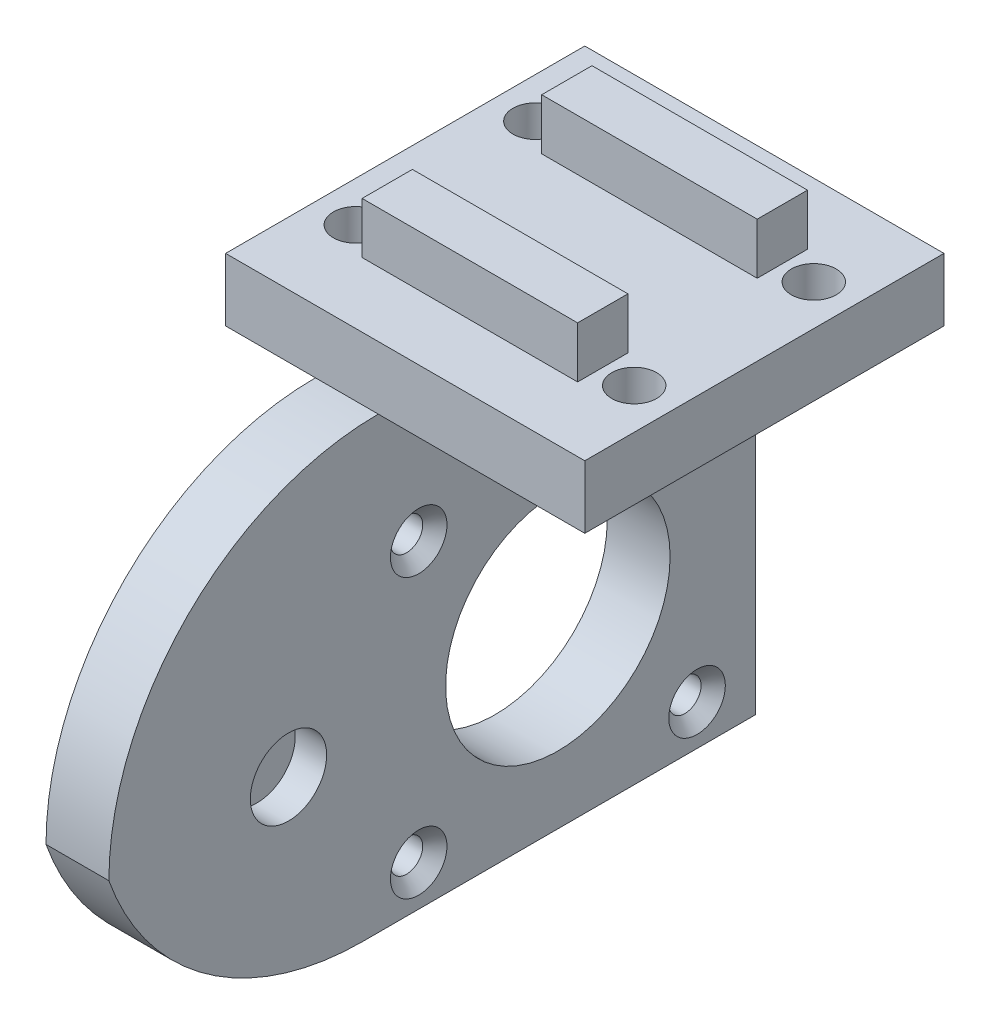
from build123d import *

# Parameters (mm, degrees)
CROQUIS1_W                                           = 40
CROQUIS1_H                                           = 40
SALIENTE_EXTRUIR1_DEPTH                              = 7
CROQUIS3_W                                           = 5.6
CROQUIS3_H                                           = 5.7
SALIENTE_EXTRUIR3_DEPTH                              = 40
CROQUIS19_W                                          = 8
CROQUIS19_H                                          = 40
CORTAR_EXTRUIR5_DEPTH                                = 5.7
CROQUIS20_R                                          = 2.5
CORTAR_EXTRUIR6_DEPTH                                = 7
CROQUIS21_W                                          = 7
CROQUIS21_H                                          = 72
SALIENTE_EXTRUIR4_DEPTH                              = 50
CROQUIS22_R                                          = 12.5
CORTAR_EXTRUIR7_DEPTH                                = 7
AVELLANADO_PARA_TORNILLO_CON_CABEZA_PLAN_D           = 3.6
AVELLANADO_PARA_TORNILLO_CON_CABEZA_PLAN_CSINK_D     = 6.3
AVELLANADO_PARA_TORNILLO_CON_CABEZA_PLAN_CSINK_ANGLE = 90
CROQUIS25_R                                          = 4.25
CORTAR_EXTRUIR8_DEPTH                                = 3.5
REDONDEO1_R                                          = 30
REDONDEO2_R                                          = 30


# Some blends are built 0.0001 mm under size
with BuildPart() as part:
    # Croquis1 → Saliente-Extruir1 (new body)
    with BuildSketch(Plane(origin=(0, 0, 0), x_dir=(1, 0, 0), z_dir=(0, 1, 0))):
        Rectangle(CROQUIS1_W, CROQUIS1_H)
    extrude(amount=SALIENTE_EXTRUIR1_DEPTH)

    # Croquis3 → Saliente-Extruir3 (add)
    with BuildSketch(Plane.ZY.offset(20)):
        with Locations((10, 9.85)):
            Rectangle(CROQUIS3_W, CROQUIS3_H)
        with Locations((-10, 9.85)):
            Rectangle(CROQUIS3_W, CROQUIS3_H)
    extrude(amount=-SALIENTE_EXTRUIR3_DEPTH)

    # Croquis19 → Cortar-Extruir5 (cut)
    with BuildSketch(Plane(origin=(0, 12.7, 0), x_dir=(1, 0, 0), z_dir=(0, 1, 0))):
        with Locations((-16, 0)):
            Rectangle(CROQUIS19_W, CROQUIS19_H)
        with Locations((16, 0)):
            Rectangle(CROQUIS19_W, CROQUIS19_H)
    extrude(amount=-CORTAR_EXTRUIR5_DEPTH, mode=Mode.SUBTRACT)

    # Croquis20 → Cortar-Extruir6 (cut)
    with BuildSketch(Plane(origin=(0, 7, 0), x_dir=(1, 0, 0), z_dir=(0, 1, 0))):
        with Locations(Location((-15.5, 10, 0), (0, 0, 270))):
            Circle(CROQUIS20_R)
        with Locations(Location((15.5, 10, 0), (0, 0, 270))):
            Circle(CROQUIS20_R)
        with Locations(Location((15.5, -10, 0), (0, 0, 270))):
            Circle(CROQUIS20_R)
        with Locations(Location((-15.5, -10, 0), (0, 0, 270))):
            Circle(CROQUIS20_R)
    extrude(amount=-CORTAR_EXTRUIR6_DEPTH, mode=Mode.SUBTRACT)

    # Croquis21 → Saliente-Extruir4 (add)
    with BuildSketch(Plane.XZ):
        with Locations((-6.5, 14)):
            Rectangle(CROQUIS21_W, CROQUIS21_H)
    extrude(amount=SALIENTE_EXTRUIR4_DEPTH)

    # Croquis22 → Cortar-Extruir7 (cut)
    with BuildSketch(Plane(origin=(-3, 0, 0), x_dir=(0, 0, -1), z_dir=(1, 0, 0))):
        with Locations((0, -30)):
            Circle(CROQUIS22_R)
    extrude(amount=-CORTAR_EXTRUIR7_DEPTH, mode=Mode.SUBTRACT)

    # Avellanado para tornillo con cabeza plana de M31 (through all)
    with Locations(Plane(origin=(-3, -14.5, 15.5), x_dir=(0, 0, 1), z_dir=(1, 0, 0))):
        with Locations((0, 0), (-31, 0), (-31, 31), (0, 31)):
            CounterSinkHole(AVELLANADO_PARA_TORNILLO_CON_CABEZA_PLAN_D / 2, AVELLANADO_PARA_TORNILLO_CON_CABEZA_PLAN_CSINK_D / 2, counter_sink_angle=AVELLANADO_PARA_TORNILLO_CON_CABEZA_PLAN_CSINK_ANGLE)

    # Croquis25 → Cortar-Extruir8 (cut)
    with BuildSketch(Plane(origin=(-3, 0, 0), x_dir=(0, 0, -1), z_dir=(1, 0, 0))):
        with Locations((-30, -30)):
            Circle(CROQUIS25_R)
    extrude(amount=-CORTAR_EXTRUIR8_DEPTH, mode=Mode.SUBTRACT)

    # Redondeo1
    redondeo1_edges = [part.edges().sort_by_distance(p)[0] for p in [
        (-6.5, 0, 50),
    ]]
    fillet(redondeo1_edges, radius=REDONDEO1_R - 0.0001)  # a hair under: the kernel refuses the full size

    # Redondeo2
    # the kernel refuses this fillet: 30 mm, written as the material it takes off along each edge
    with BuildSketch(Plane(origin=(67.710766507, -50, 50), x_dir=(0, 1, 0), z_dir=(-1, 0, 0))) as redondeo2_piece_1:
        with BuildLine():
            CenterArc((30, 28.284306603), REDONDEO2_R, 180, 70.528981937)
            Line((0, 28.284306603), (-0.6, 28.284306603))
            Line((-0.6, 28.284306603), (-0.6, 0))
            Line((-0.6, 0), (0, -0.6))
            ThreePointArc((0, -0.6), (10.00005, -0.6), (19.800102, -0.565686132))
            Line((19.800102, -0.565686132), (20.0001, 0))
        make_face()
    extrude(amount=148.421533013, mode=Mode.SUBTRACT)


solid = part.part
